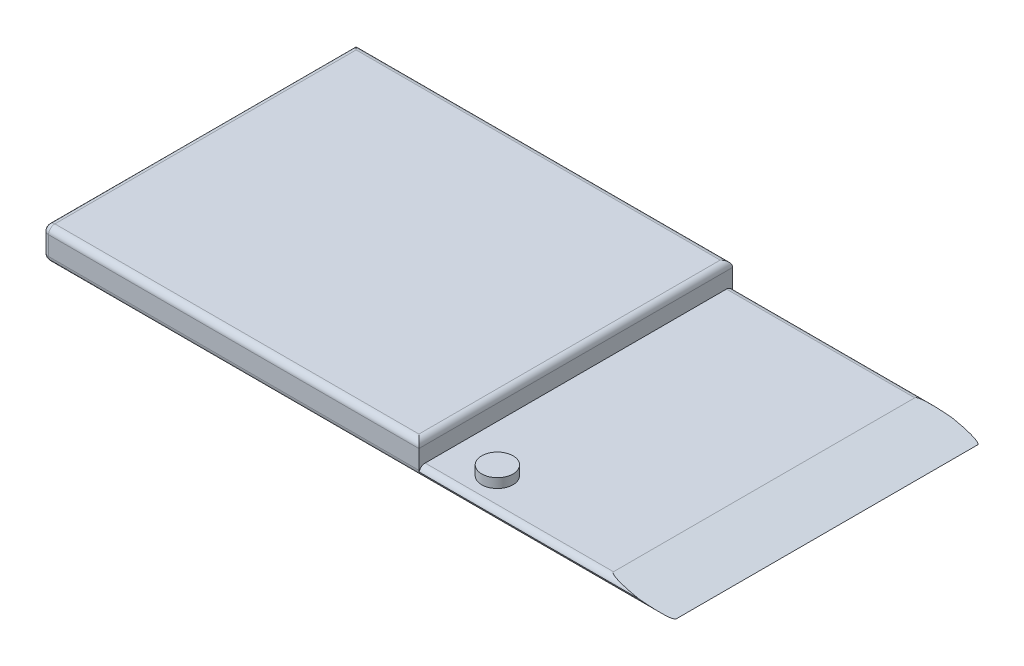
from build123d import *

# Parameters (mm, degrees)
SKETCH1_W           = 254
SKETCH1_H           = 127
BOSS_EXTRUDE1_DEPTH = 12.7
SKETCH2_OUTSIDE_W   = 312.852
SKETCH2_OUTSIDE_H   = 71.552
CUT_EXTRUDE2_DEPTH  = 181.05357536
FILLET1_R           = 2.54
FILLET4_R           = 2.54
FILLET5_R           = 2.54
SKETCH3_R           = 6.35
BOSS_EXTRUDE2_DEPTH = 3.81


with BuildPart() as part:
    # Sketch1 → Boss-Extrude1 (new body)
    with BuildSketch(Plane(origin=(0, 0, 0), x_dir=(1, 0, 0), z_dir=(0, 1, 0))):
        Rectangle(SKETCH1_W, SKETCH1_H)
    extrude(amount=BOSS_EXTRUDE1_DEPTH)

    # Sketch2 outside → Cut-Extrude2 (cut, through all)
    with BuildSketch(Plane.XY.offset(63.5)):
        with Locations((0, 6.35)):
            Rectangle(SKETCH2_OUTSIDE_W, SKETCH2_OUTSIDE_H)
        Polygon((25.4, 12.7), (25.4, 3.81), (101.6, 3.81), (127, 0), (-127, 0), (-127, 12.7), align=None, mode=Mode.SUBTRACT)
    extrude(amount=-CUT_EXTRUDE2_DEPTH, mode=Mode.SUBTRACT)

    # Fillet1
    fillet1_edges = [part.edges().sort_by_distance(p)[0] for p in [
        (-127, 12.7, 0),
        (-50.8, 12.7, -63.5),
        (-50.8, 12.7, 63.5),
        (25.4, 12.7, 0),
    ]]
    fillet(fillet1_edges, radius=FILLET1_R)

    # Fillet4
    fillet4_edges = [part.edges().sort_by_distance(p)[0] for p in [
        (63.5, 3.81, -63.5),
    ]]
    fillet(fillet4_edges, radius=FILLET4_R)
    fillet4_2_edges = [part.edges().sort_by_distance(p)[0] for p in [
        (63.5, 3.81, 63.5),
    ]]
    fillet(fillet4_2_edges, radius=FILLET4_R)
    fillet4_3_edges = [part.edges().sort_by_distance(p)[0] for p in [
        (0, 0, 63.5),
    ]]
    fillet(fillet4_3_edges, radius=FILLET4_R)

    # Fillet5
    # the kernel refuses this fillet: 2.54 mm, written as the material it takes off along each edge
    with BuildSketch(Plane(origin=(-124.46, 10.16, 60.96), x_dir=(-1, 0, 0), z_dir=(0, 0, 1))) as fillet5_piece_1_section:
        Polygon((0, 0), (FILLET5_R, 0), (FILLET5_R, -FILLET5_R), (0, -FILLET5_R), align=None)
    fillet5_piece_1 = extrude(amount=FILLET5_R, mode=Mode.PRIVATE)
    fillet5_piece_1 = fillet5_piece_1 - Plane(origin=(-124.46, 10.16, 60.96), x_dir=(0.7071067811865475, -0.7071067811865475, 0), z_dir=(0, 0, 1)) * Sphere(FILLET5_R, mode=Mode.PRIVATE)
    add(fillet5_piece_1, mode=Mode.SUBTRACT)
    with BuildSketch(Plane(origin=(-127, 2.54, 63.5), x_dir=(1, 0, 0), z_dir=(0, 1, 0))) as fillet5_piece_2:
        with BuildLine():
            CenterArc((FILLET5_R, FILLET5_R), FILLET5_R, 180, 90)
            Line((0, FILLET5_R), (0, 0))
            Line((0, 0), (FILLET5_R, 0))
        make_face()
    extrude(amount=7.62, mode=Mode.SUBTRACT)
    with BuildSketch(Plane(origin=(-127, 2.54, 60.96), x_dir=(0, -1, 0), z_dir=(0, 0, -1))) as fillet5_piece_3:
        with BuildLine():
            CenterArc((2.54 - FILLET5_R, -FILLET5_R), FILLET5_R, 0, 90)
            Line((2.54 - FILLET5_R, 0), (2.54, 0))
            Line((2.54, 0), (2.54, -FILLET5_R))
        make_face()
    revolve(axis=Axis((-127, 2.54, 60.96), (-1, 0, 0)), revolution_arc=90, mode=Mode.SUBTRACT)
    with BuildSketch(Plane(origin=(-127, 0, 60.96), x_dir=(1, 0, 0), z_dir=(0, 0, -1))) as fillet5_piece_4:
        with BuildLine():
            CenterArc((FILLET5_R, -FILLET5_R), FILLET5_R, 90, 90)
            Line((0, -FILLET5_R), (0, 0))
            Line((0, 0), (FILLET5_R, 0))
        make_face()
    extrude(amount=130.81, mode=Mode.SUBTRACT)
    with BuildSketch(Plane(origin=(-133.35, 0, -63.5), x_dir=(0, 1, 0), z_dir=(1, 0, 0))) as fillet5_piece_5:
        with BuildLine():
            CenterArc((FILLET5_R, FILLET5_R), FILLET5_R, 180, 90)
            Line((0, FILLET5_R), (0, 0))
            Line((0, 0), (FILLET5_R, 0))
        make_face()
    extrude(amount=266.7, mode=Mode.SUBTRACT)

    # Sketch3 → Boss-Extrude2 (add)
    with BuildSketch(Plane(origin=(0, 3.81, 0), x_dir=(1, 0, 0), z_dir=(0, 1, 0))):
        with Locations(Location((44.45, -50.8, 0), (0, 0, 90))):
            Circle(SKETCH3_R)
    extrude(amount=BOSS_EXTRUDE2_DEPTH)


solid = part.part
